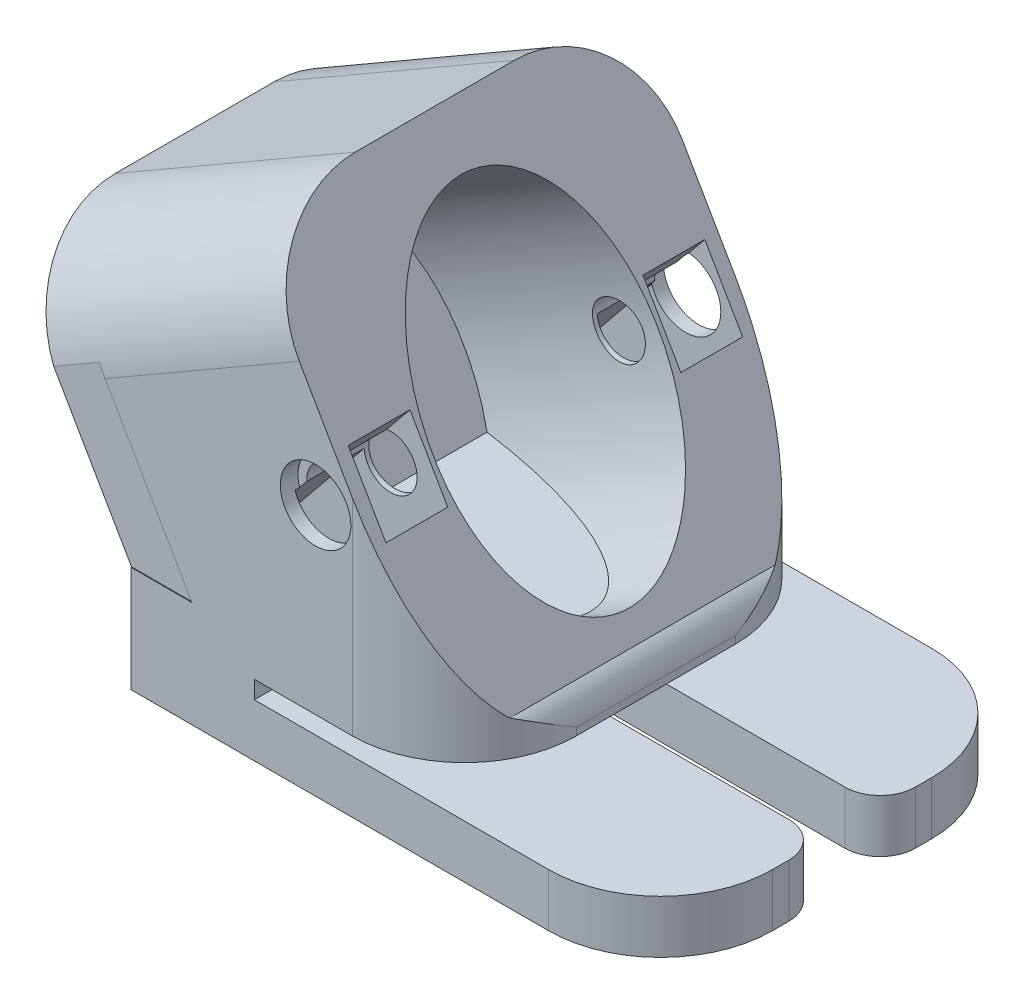
from build123d import *

# Parameters (mm, degrees)
SKETCH2_W           = 21.7
SKETCH2_H           = 25.05
SKETCH2_RX          = 9.525
SKETCH2_RY          = 6.35
BOSS_EXTRUDE1_DEPTH = 12.7
SKETCH3_W           = 21.660653916
SKETCH3_H           = 25.05
BOSS_EXTRUDE2_DEPTH = 3
SKETCH5_W           = 18.892037138
SKETCH5_H           = 21.7
BOSS_EXTRUDE3_DEPTH = 2
SKETCH6_W           = 30
SKETCH6_H           = 21.7
BOSS_EXTRUDE4_DEPTH = 4
SKETCH7_W           = 21.7
SKETCH7_H           = 1
SKETCH7_W_2         = 3.175
SKETCH7_H_2         = 3
CUT_EXTRUDE2_DEPTH  = 23
SKETCH7_3_W         = 21.7
SKETCH7_3_H         = 7.272473706
CUT_EXTRUDE3_DEPTH  = 44.803879418
SKETCH11_R          = 1
CUT_EXTRUDE8_DEPTH  = 33.487034031
SKETCH15_W          = 4
SKETCH15_H          = 3.5
CUT_EXTRUDE9_DEPTH  = 28.443249292
CUT_EXTRUDE4_REACH  = 47.088
SKETCH9_R           = 1.5
SKETCH10_R          = 2
CUT_EXTRUDE7_DEPTH  = 1
FILLET5_R           = 6.35
FILLET6_R           = 2
FILLET7_R           = 2


with BuildPart() as part:
    # Sketch2 → Boss-Extrude1 (new body)
    with BuildSketch(Plane(origin=(16.497783942, 9.525, 0), x_dir=(0, 0, -1), z_dir=(0.8660254037844379, 0.5000000000000013, 0))):
        Rectangle(SKETCH2_W, SKETCH2_H)
        with Locations(Location((0, 0), (0, 0, 90))):
            Ellipse(SKETCH2_RX, SKETCH2_RY, mode=Mode.SUBTRACT)
    extrude(amount=-BOSS_EXTRUDE1_DEPTH)

    # Sketch3 → Boss-Extrude2 (add)
    with BuildSketch(Plane(origin=(5.499261314, 3.175, 0), x_dir=(0, 0, 1), z_dir=(-0.8660254037844379, -0.5000000000000014, 0))):
        with Locations((-0.019673042, 0)):
            Rectangle(SKETCH3_W, SKETCH3_H)
    extrude(amount=BOSS_EXTRUDE2_DEPTH)

    # Sketch5 → Boss-Extrude3 (add)
    with BuildSketch(Plane(origin=(0, 0, 0), x_dir=(-1, 0, 0), z_dir=(0, 1, 0))):
        with Locations((-13.314265373, 0)):
            Rectangle(SKETCH5_W, SKETCH5_H)
    extrude(amount=-BOSS_EXTRUDE3_DEPTH)

    # Sketch6 → Boss-Extrude4 (add)
    with BuildSketch(Plane.XZ.offset(2)):
        with Locations((18.868246804, 0)):
            Rectangle(SKETCH6_W, SKETCH6_H)
    extrude(amount=BOSS_EXTRUDE4_DEPTH)

    # Sketch7 → Cut-Extrude2 (cut)
    with BuildSketch(Plane(origin=(33.868246804, 0, 0), x_dir=(0, 0, -1), z_dir=(1, 0, 0))):
        with Locations((0, -2.5)):
            Rectangle(SKETCH7_W, SKETCH7_H)
        with Locations((0, -4.5)):
            Rectangle(SKETCH7_W_2, SKETCH7_H_2)
    extrude(amount=-CUT_EXTRUDE2_DEPTH, mode=Mode.SUBTRACT)

    # Sketch7<3> → Cut-Extrude3 (cut, through all)
    with BuildSketch(Plane(origin=(33.868246804, 0, 0), x_dir=(0, 0, -1), z_dir=(1, 0, 0))):
        with Locations((0, -9.636236853)):
            Rectangle(SKETCH7_3_W, SKETCH7_3_H)
    extrude(amount=-CUT_EXTRUDE3_DEPTH, mode=Mode.SUBTRACT)

    # Sketch11 → Cut-Extrude8 (cut, through all)
    with BuildSketch(Plane(origin=(19.672783942, 0.194872981, 0), x_dir=(0, 0, -1), z_dir=(-1, 0, 0))):
        with Locations(Location((0, -3.830865705, 0), (0, 0, 90))):
            Circle(SKETCH11_R)
    extrude(amount=CUT_EXTRUDE8_DEPTH, mode=Mode.SUBTRACT)

    # Sketch15 → Cut-Extrude9 (cut, symmetric)
    with BuildSketch(Plane(origin=(16.497783942, 9.525, 0), x_dir=(0.7757354378747654, -0.6310582623064579, 0), z_dir=(0.6310582623064579, 0.7757354378747654, 0))):
        with Locations((0, -8.35)):
            Rectangle(SKETCH15_W, SKETCH15_H)
    cut_extrude9 = extrude(amount=CUT_EXTRUDE9_DEPTH, both=True, mode=Mode.SUBTRACT)

    # Sketch9 → Cut-Extrude4 (cut, up to next)
    with BuildSketch(Plane(origin=(0, 0, -10.85), x_dir=(-1, 0, 0), z_dir=(0, 0, -1)), mode=Mode.PRIVATE) as cut_extrude4_sk1:
        with Locations((-14.332720433, 8.275)):
            Circle(SKETCH9_R)
    cut_extrude4_tool1 = extrude(cut_extrude4_sk1.sketch, amount=-CUT_EXTRUDE4_REACH, mode=Mode.PRIVATE) & part.part
    cut_extrude4 = cut_extrude4_tool1.solids().sort_by_distance((14.33272, 8.275, -10.85))[0]
    add(cut_extrude4, mode=Mode.SUBTRACT)

    # Sketch10 → Cut-Extrude7 (cut)
    with BuildSketch(Plane(origin=(0, 0, -10.85), x_dir=(-1, 0, 0), z_dir=(0, 0, -1))):
        with Locations((-14.332720433, 8.275)):
            Circle(SKETCH10_R)
    cut_extrude7 = extrude(amount=-CUT_EXTRUDE7_DEPTH, mode=Mode.SUBTRACT)

    # Mirror1: Cut-Extrude9, Cut-Extrude4, Cut-Extrude7 across plane
    add(cut_extrude9.mirror(Plane.XY), mode=Mode.SUBTRACT)
    add(cut_extrude4.mirror(Plane.XY), mode=Mode.SUBTRACT)
    add(cut_extrude7.mirror(Plane.XY), mode=Mode.SUBTRACT)

    # Fillet5
    fillet5_edges = [part.edges().sort_by_distance(p)[0] for p in [
        (33.868246804, -4.5, 10.85),
        (33.868246804, -4.5, -10.85),
        (22.760283942, -1, -10.85),
        (22.760283942, -1, 10.85),
        (4.736022628, 17.196968182, 10.85),
        (3.436984522, 16.446968182, -10.85),
    ]]
    fillet(fillet5_edges, radius=FILLET5_R)

    # Fillet6
    fillet6_edges = [part.edges().sort_by_distance(p)[0] for p in [
        (33.868246804, -4.5, 1.5875),
        (33.868246804, -4.5, -1.5875),
    ]]
    fillet(fillet6_edges, radius=FILLET6_R)

    # Fillet7
    # the kernel refuses this fillet: 2 mm, written as the material it takes off along each edge
    with BuildSketch(Plane(origin=(22.760283942, 0, 8.429393602), x_dir=(-1, 0, 0), z_dir=(0, 0, -1))) as fillet7_piece_1:
        with BuildLine():
            CenterArc((2, -1.571757441), FILLET7_R, 128.197977663, 51.802022337)
            Line((0, -1.571757441), (-0.04, -1.571757441))
            Line((-0.04, -1.571757441), (-0.04, 0))
            Line((-0.04, 0), (0, 0.04))
            ThreePointArc((0, 0.04), (0.381619343, 0.04), (0.73850346, 0.031435149))
            Line((0.73850346, 0.031435149), (0.763238686, 0))
        make_face()
    extrude(amount=16.858787203, mode=Mode.SUBTRACT)


solid = part.part
